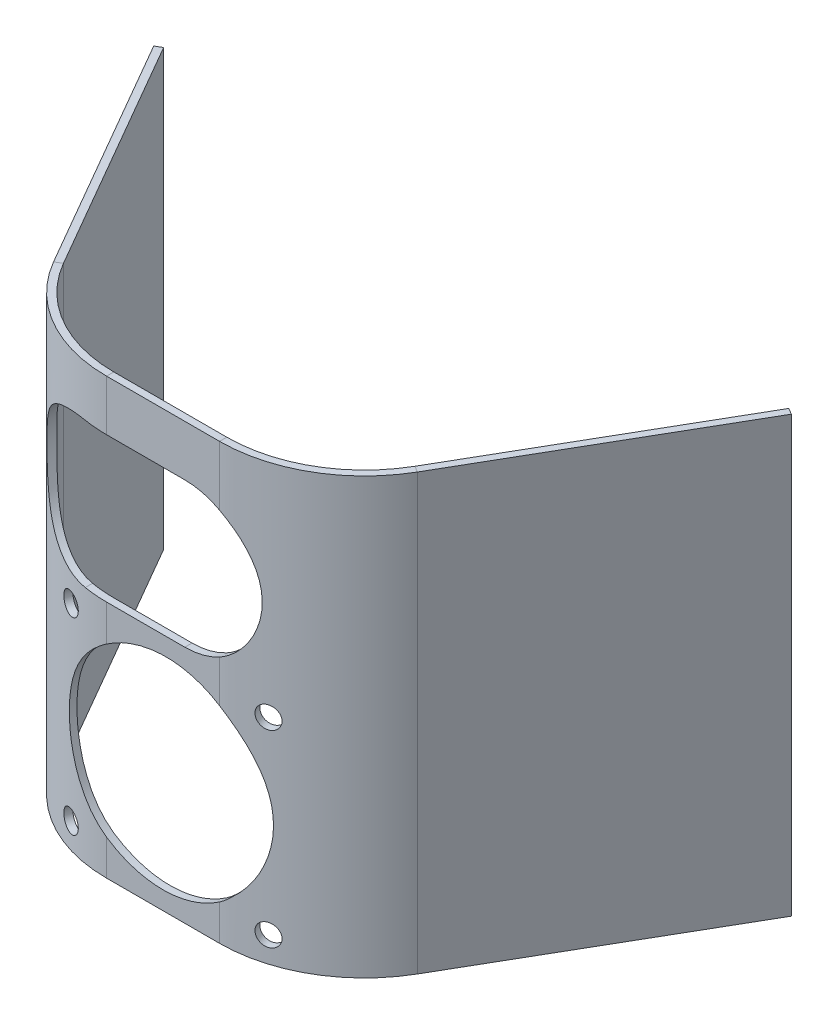
from build123d import *

# Parameters (mm, degrees)
T_LE_PLI_E_BALAY_E2_DEPTH = 60
ENL_V_MAT_EXTRU_1_DEPTH   = 103.644714472
ESQUISSE6_R               = 1.5
ENL_V_MAT_EXTRU_3_DEPTH   = 93.058144049


# Read off the part's stored shape, not the designer's step: Tôle pliée balayée2
with BuildPart() as part:
    # Tôle pliée balayée2 outline → Tôle pliée balayée2 (new body)
    with BuildSketch(Plane(origin=(0, 0, 0), x_dir=(1, 0, 0), z_dir=(0, 1, 0))):
        with BuildLine():
            Line((-24.248711306, 38), (-43.133974596, 70.710235533))
            Line((-43.133974596, 70.710235533), (-44, 70.210235533))
            Line((-44, 70.210235533), (-25.11473671, 37.5))
            ThreePointArc((-25.11473671, 37.5), (-17.794228634, 30.179491924), (-7.794228634, 27.5))
            Line((-7.794228634, 27.5), (7.794228634, 27.5))
            ThreePointArc((7.794228634, 27.5), (17.794228634, 30.179491924), (25.11473671, 37.5))
            Line((25.11473671, 37.5), (44, 70.210235533))
            Line((44, 70.210235533), (43.133974596, 70.710235533))
            Line((43.133974596, 70.710235533), (24.248711306, 38))
            ThreePointArc((24.248711306, 38), (17.294228634, 31.045517328), (7.794228634, 28.5))
            Line((7.794228634, 28.5), (-7.794228634, 28.5))
            ThreePointArc((-7.794228634, 28.5), (-17.294228634, 31.045517328), (-24.248711306, 38))
        make_face()
    extrude(amount=T_LE_PLI_E_BALAY_E2_DEPTH)

    # Esquisse5 → Enlèv. mat.-Extru.1 (cut, through all)
    with BuildSketch(Plane.XY):
        with BuildLine():
            Line((3, 33), (-11, 33))
            ThreePointArc((-11, 33), (-21, 43), (-11, 53))
            Line((-11, 53), (3, 53))
            ThreePointArc((3, 53), (13, 43), (3, 33))
        make_face()
        with BuildLine():
            ThreePointArc((-1.600604457, 30.408201371), (11.902498584, 24.374165391), (12.17398989, 9.586681683))
            add(Edge.make_bspline(
                [(-1.600604457, 30.408201371), (-2.776308248, 30.249178337), (-3.938914805, 29.929645561), (-5.592731898, 29.24807604), (-6.131038973, 28.986247115), (-7.162899805, 28.407385831), (-7.659055476, 28.089844196), (-8.609904515, 27.39581976), (-9.064752325, 27.019556507), (-9.715303321, 26.410068713), (-9.927714845, 26.199011203), (-10.335351995, 25.76675107), (-10.531019865, 25.544993202), (-11.469843924, 24.408919813), (-12.098747193, 23.415716292), (-12.851200055, 21.794099236), (-13.065698649, 21.239125671), (-13.420825422, 20.114461769), (-13.562726045, 19.542819631), (-13.721879511, 18.671338061), (-13.765926682, 18.378493608), (-13.835335622, 17.787926655), (-13.860600686, 17.48965917), (-13.906863648, 16.600128206), (-13.899585132, 16.010113331), (-13.813003211, 14.835762679), (-13.733692341, 14.251427491), (-13.499250258, 13.088735482), (-13.342516827, 12.509813887), (-12.772060847, 10.8311622), (-12.258470701, 9.770865872), (-10.949208493, 7.774725521), (-10.180850305, 6.878974794), (-9.085726964, 5.888734507), (-8.859821855, 5.697154856), (-8.393980985, 5.327185986), (-8.153725166, 5.148669631), (-7.422211217, 4.640702709), (-6.916973497, 4.336006696), (-5.872105213, 3.793099426), (-5.332534247, 3.55477296), (-4.496898722, 3.248083301), (-4.212896537, 3.1540617), (-3.642078588, 2.985373438), (-3.355320462, 2.910644364), (-2.491093042, 2.714629442), (-1.909696746, 2.621330331), (-0.736520758, 2.508731903), (-0.14418064, 2.488696238), (1.646011475, 2.551388855), (2.807186244, 2.749699948), (4.503572066, 3.267137513), (5.064281764, 3.477967958), (5.87818023, 3.845336417), (6.145521018, 3.975931721), (6.671517974, 4.254978049), (6.93038897, 4.403705723), (7.314251165, 4.633074279), (7.441425815, 4.710657538), (7.690225446, 4.873849154), (7.812696124, 4.958234592), (8.176873883, 5.216067831), (8.410307093, 5.402192266), (8.865069392, 5.788723237), (9.084408956, 5.990730695), (9.518498443, 6.399734987), (9.734867065, 6.604996239), (10.165396387, 7.017820303), (10.374732226, 7.229627665), (10.77542937, 7.66959952), (10.96846293, 7.896242233), (11.526168376, 8.595640399), (11.866190811, 9.082094062), (12.17398989, 9.586681683)],
                knots=[0, 0, 0, 0, 0.0625, 0.0625, 0.09375, 0.09375, 0.125, 0.125, 0.15625, 0.15625, 0.171875, 0.171875, 0.1875, 0.1875, 0.25, 0.25, 0.28125, 0.28125, 0.3125, 0.3125, 0.328125, 0.328125, 0.34375, 0.34375, 0.375, 0.375, 0.40625, 0.40625, 0.4375, 0.4375, 0.5, 0.5, 0.5625, 0.5625, 0.578125, 0.578125, 0.59375, 0.59375, 0.625, 0.625, 0.65625, 0.65625, 0.671875, 0.671875, 0.6875, 0.6875, 0.71875, 0.71875, 0.75, 0.75, 0.8125, 0.8125, 0.84375, 0.84375, 0.859375, 0.859375, 0.875, 0.875, 0.8828125, 0.8828125, 0.890625, 0.890625, 0.90625, 0.90625, 0.921875, 0.921875, 0.9375, 0.9375, 0.953125, 0.953125, 0.96875, 0.96875, 1, 1, 1, 1], degree=3))
        make_face()
    extrude(amount=-ENL_V_MAT_EXTRU_1_DEPTH, mode=Mode.SUBTRACT)

    # Esquisse6 → Enlèv. mat.-Extru.3 (cut, symmetric)
    with BuildSketch(Plane(origin=(7.059508944, 0, -23.090613315), x_dir=(0.9563047559630372, 0, 0.2923717047227314), z_dir=(-0.29237170472273133, 0, 0.9563047559630371))):
        with Locations(Location((-21.341313886, 29.5, 0), (0, 0, 180))):
            Circle(ESQUISSE6_R)
        with Locations(Location((-21.341313886, 3.5, 0), (0, 0, 180))):
            Circle(ESQUISSE6_R)
    enl_v_mat_extru_3 = extrude(amount=ENL_V_MAT_EXTRU_3_DEPTH, both=True, mode=Mode.SUBTRACT)

    # Symétrie1: Enlèv. mat.-Extru.3 across plane
    add(enl_v_mat_extru_3.mirror(Plane(origin=(0, 0, 0), x_dir=(0, 0, 1), z_dir=(1, 0, 0))), mode=Mode.SUBTRACT)


solid = part.part
